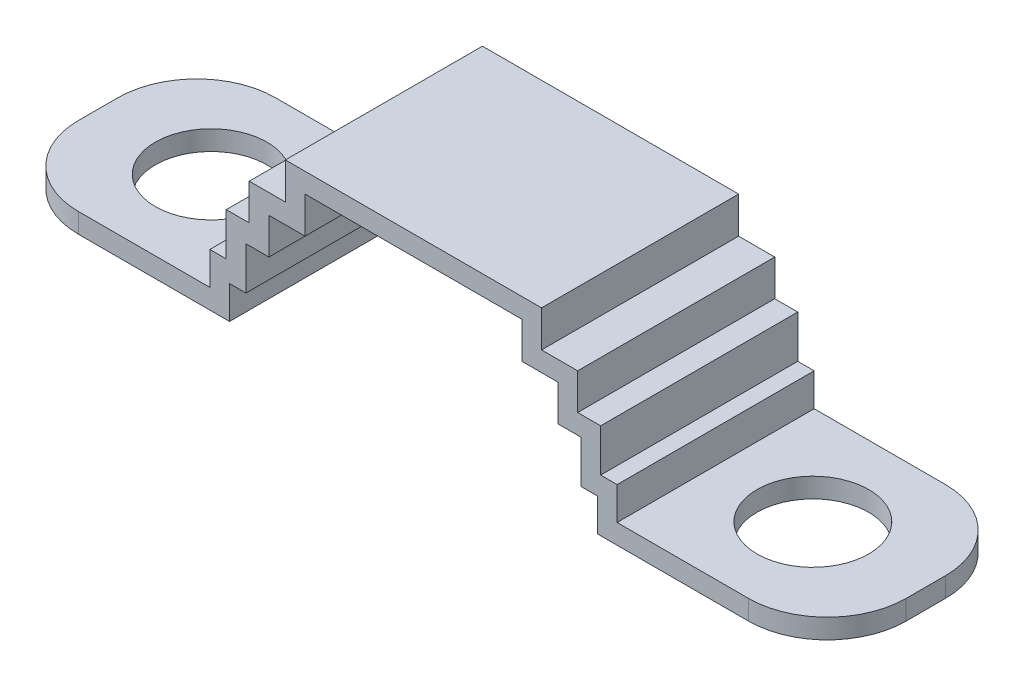
from build123d import *

# Parameters (mm, degrees)
EXTRUDE_THIN1_DEPTH  = 15
SKETCH2_R            = 8.5
CUT_EXTRUDE1_DEPTH   = 69.574794932
FILLET1_R            = 12
FILLET1_OF_MIRROR1_R = 12


with BuildPart() as part:
    # Sketch1 → Extrude-Thin1 (new, symmetric)
    with BuildSketch(Plane.XY):
        Polygon((-63, 4.5), (-28, 4.5), (-28, 9.5), (-25.5, 9.5), (-25.5, 16), (-22, 16), (-22, 21.5), (-16.5, 21.5), (-16.5, 27.05), (0, 27.05), (0, 30.05), (-19.5, 30.05), (-19.5, 24.5), (-25, 24.5), (-25, 19), (-28.5, 19), (-28.5, 12.5), (-31, 12.5), (-31, 7.5), (-63, 7.5), align=None)
    extrude_thin1 = extrude(amount=EXTRUDE_THIN1_DEPTH, both=True)

    # Sketch2 → Cut-Extrude1 (cut, through all)
    with BuildSketch(Plane(origin=(0, 7.5, 0), x_dir=(1, 0, 0), z_dir=(0, 1, 0))):
        with Locations((-45.8, 0)):
            Circle(SKETCH2_R)
    cut_extrude1 = extrude(amount=-CUT_EXTRUDE1_DEPTH, mode=Mode.SUBTRACT)

    # Fillet1
    fillet1_edges = [part.edges().sort_by_distance(p)[0] for p in [
        (-63, 6, -15),
        (-63, 6, 15),
    ]]
    fillet(fillet1_edges, radius=FILLET1_R)

    # Mirror1: Extrude-Thin1, Cut-Extrude1 across plane
    add(extrude_thin1.mirror(Plane(origin=(0, 30.05, 15), x_dir=(0, 0, 1), z_dir=(1, 0, 0))))
    add(cut_extrude1.mirror(Plane(origin=(0, 30.05, 15), x_dir=(0, 0, 1), z_dir=(1, 0, 0))), mode=Mode.SUBTRACT)

    # Fillet1 of Mirror1
    fillet1_of_mirror1_edges = [part.edges().sort_by_distance(p)[0] for p in [
        (63, 6, -15),
        (63, 6, 15),
    ]]
    fillet(fillet1_of_mirror1_edges, radius=FILLET1_OF_MIRROR1_R)


solid = part.part
